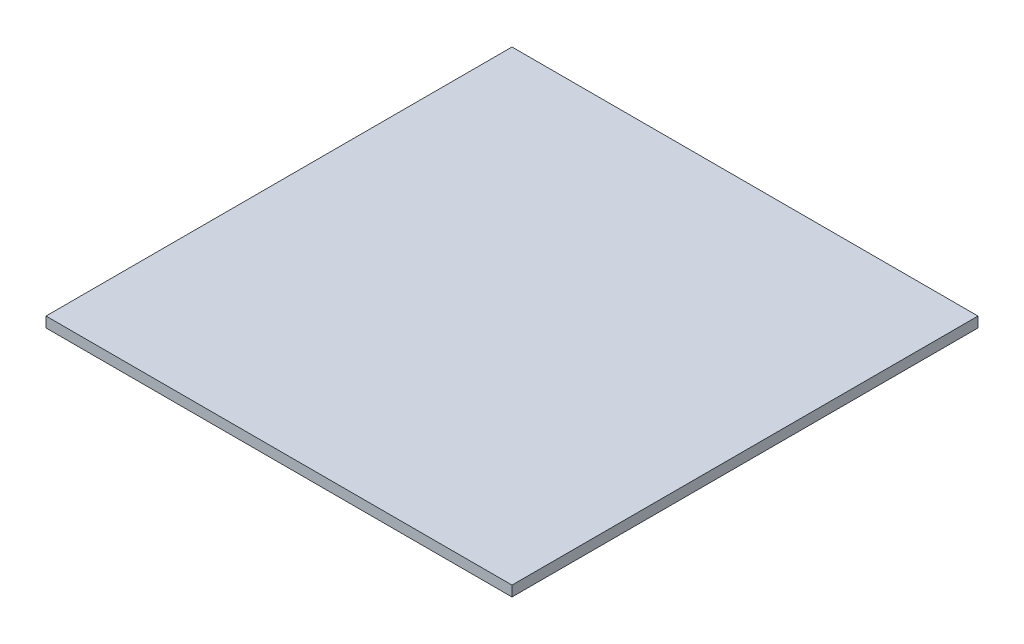
from build123d import *

# Parameters (mm, degrees)
SKIZZE1_W                       = 90
SKIZZE1_H                       = 90
AUFSATZ_LINEAR_AUSTRAGEN1_DEPTH = 2


with BuildPart() as part:
    # Skizze1 → Aufsatz-Linear austragen1 (new body)
    with BuildSketch(Plane(origin=(0, 0, 0), x_dir=(1, 0, 0), z_dir=(0, 1, 0))):
        Rectangle(SKIZZE1_W, SKIZZE1_H)
    extrude(amount=AUFSATZ_LINEAR_AUSTRAGEN1_DEPTH)


solid = part.part
